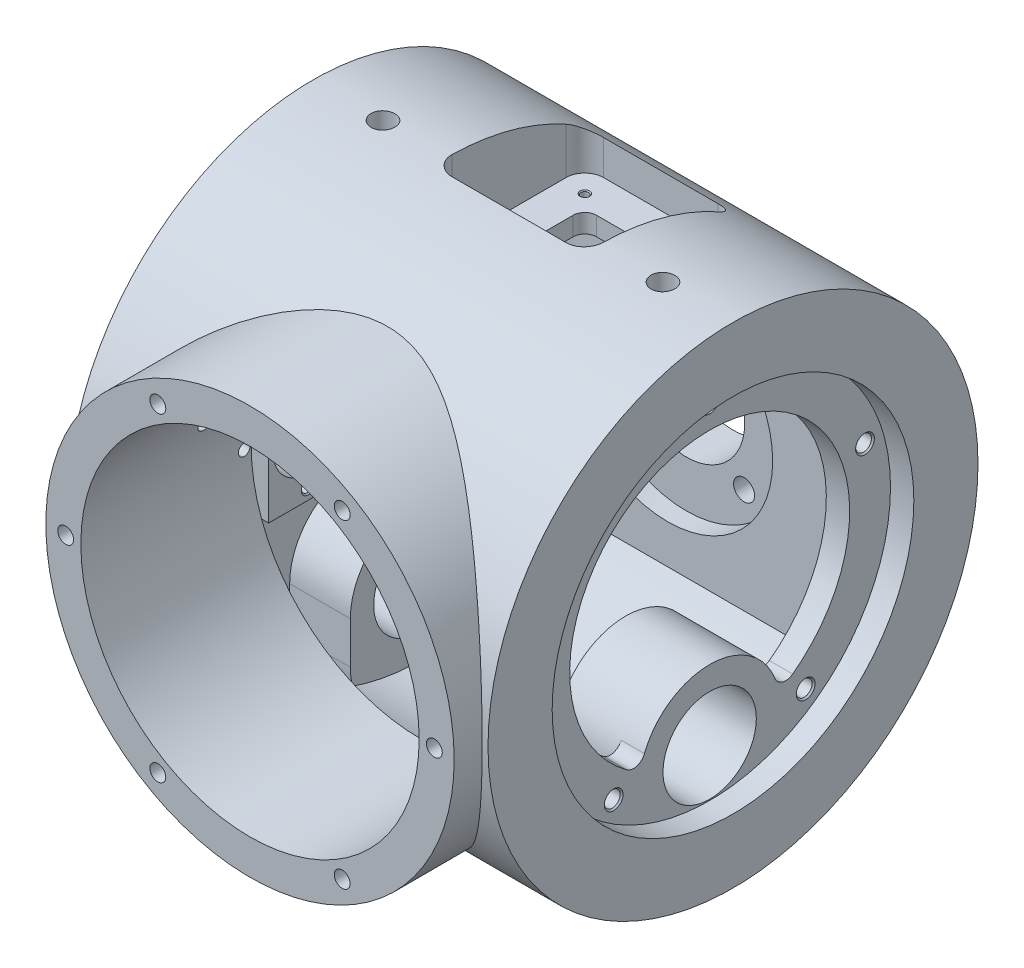
from build123d import *

# Parameters (mm, degrees)
SKETCH_2_R                   = 105
EXTRUDE_1_DEPTH              = 90
SKETCH_3_R                   = 87.5
EXTRUDE_2_DEPTH              = 117
SKETCH_4_R                   = 72.5
CUT_EXTRUDE_1_DEPTH          = 73
SKETCH_5_R                   = 77.5
CUT_EXTRUDE_2_DEPTH          = 10
SKETCH_7_R                   = 60
CUT_EXTRUDE_3_DEPTH          = 10
CUT_EXTRUDE_4_DEPTH          = 70
EXTRUDE_3_DEPTH              = 36
SKETCH_10_R                  = 20
CUT_EXTRUDE_5_DEPTH          = 36
CUT_EXTRUDE_START            = -10
SKETCH_11_R                  = 77.5
CUT_EXTRUDE_6_DEPTH          = 10
EXTRUDE_4_DEPTH              = 5
CUT_EXTRUDE_7_DEPTH          = 10
SKETCH_14_R                  = 15
CUT_EXTRUDE_8_DEPTH          = 221.769110329
SKETCH_15_R                  = 45
CUT_EXTRUDE_9_DEPTH          = 8
SKETCH_16_R                  = 25
CUT_EXTRUDE_10_DEPTH         = 20
SKETCH_17_R                  = 45
CUT_EXTRUDE_11_DEPTH         = 249.94577739
HOLE_WIZARD_M6_1_D           = 5
HOLE_WIZARD_M6_1_CSINK_D     = 6.05
HOLE_WIZARD_M6_1_CSINK_ANGLE = 90
PATTERN_CIRCULAR_1_COUNT     = 4
PATTERN_CIRCULAR_2_COUNT     = 5
FILLET_1_R                   = 5
CUT_EXTRUDE_START_2          = 8
CUT_EXTRUDE_12_DEPTH         = 217.388056891
CUT_EXTRUDE_13_REACH         = 232.473
CUT_EXTRUDE_START_3          = 61
SKETCH_26_W                  = 11
SKETCH_26_H                  = 11
CUT_EXTRUDE_14_DEPTH         = 121.146349847
F_10_0MM_1_D                 = 10
F_10_0MM_1_DEPTH             = 12
F_10_0MM_1_TIP               = 3.004303095
F_3_0MM_1_REACH              = 224.137
F_3_0MM_1_BORE_R             = 1.5
PATTERN_CIRCULAR_3_COUNT     = 6
HOLE_START                   = -90
HOLE_WIZARD_1_OUTLINE_R      = 4.5
HOLE_WIZARD_1_DEPTH          = 20
HOLE_WIZARD_1_2_OUTLINE_R    = 7
HOLE_WIZARD_1_2_OUTLINE_R_2  = 4.5
HOLE_WIZARD_1_2_DEPTH        = 6
PATTERN_CIRCULAR_4_COUNT     = 4
CUT_EXTRUDE_15_REACH         = 226.308
SKETCH_39_R                  = 2.5
CUT_EXTRUDE_16_DEPTH         = 182.146349847


# Read off the part's stored shape, not the designer's step: M4 螺纹孔1, M8 螺纹孔2, 孔1, M12 螺纹孔1
with BuildPart() as part:
    # 草图2 → 凸台-拉伸1 (new, symmetric)
    with BuildSketch(Plane(origin=(0, 0, 0), x_dir=(0, 0, -1), z_dir=(1, 0, 0))):
        with Locations(Location((0, 0, 0), (0, 0, 180))):
            Circle(SKETCH_2_R)
    extrude(amount=EXTRUDE_1_DEPTH, both=True)

    # 草图3 → 凸台-拉伸2 (add)
    with BuildSketch(Plane.XY):
        Circle(SKETCH_3_R)
    extrude(amount=EXTRUDE_2_DEPTH)

    # 草图4 → 切除-拉伸1 (cut)
    with BuildSketch(Plane.XY.offset(117)):
        Circle(SKETCH_4_R)
    extrude(amount=-CUT_EXTRUDE_1_DEPTH, mode=Mode.SUBTRACT)

    # 草图5 → 切除-拉伸2 (cut)
    with BuildSketch(Plane(origin=(90, 0, 0), x_dir=(0, 0, -1), z_dir=(1, 0, 0))):
        Circle(SKETCH_5_R)
    extrude(amount=-CUT_EXTRUDE_2_DEPTH, mode=Mode.SUBTRACT)

    # 草图7 → 切除-拉伸3 (cut)
    with BuildSketch(Plane(origin=(80, 0, 0), x_dir=(0, 0, -1), z_dir=(1, 0, 0))):
        Circle(SKETCH_7_R)
    extrude(amount=-CUT_EXTRUDE_3_DEPTH, mode=Mode.SUBTRACT)

    # 草图8 → 切除-拉伸4 (cut, symmetric)
    with BuildSketch(Plane(origin=(0, 0, 0), x_dir=(0, 0, -1), z_dir=(1, 0, 0))):
        with BuildLine():
            Line((-44, -75.632334355), (-44, 64))
            Line((-44, 64), (62, 64))
            Line((62, 64), (62, -61.743420702))
            ThreePointArc((62, -61.743420702), (11.367738588, -86.758426215), (-44, -75.632334355))
        make_face()
    extrude(amount=CUT_EXTRUDE_4_DEPTH, both=True, mode=Mode.SUBTRACT)

    # 草图9 → 凸台-拉伸3 (add)
    with BuildSketch(Plane(origin=(80, 0, 0), x_dir=(0, 0, -1), z_dir=(1, 0, 0))):
        with BuildLine():
            Line((30, -57), (30, -75))
            ThreePointArc((30, -75), (0, -105), (-30, -75))
            Line((-30, -75), (-30, -57))
            ThreePointArc((-30, -57), (0, -27), (30, -57))
        make_face()
    extrude_3 = extrude(amount=-EXTRUDE_3_DEPTH)

    # 草图10 → 切除-拉伸5 (cut)
    with BuildSketch(Plane(origin=(80, 0, 0), x_dir=(0, 0, -1), z_dir=(1, 0, 0))):
        with Locations((0, -57)):
            Circle(SKETCH_10_R)
    cut_extrude_5 = extrude(amount=-CUT_EXTRUDE_5_DEPTH, mode=Mode.SUBTRACT)

    # 镜向1: 凸台-拉伸3, 切除-拉伸5 across plane
    add(extrude_3.mirror(Plane(origin=(0, 0, 0), x_dir=(0, 0, 1), z_dir=(1, 0, 0))))
    add(cut_extrude_5.mirror(Plane(origin=(0, 0, 0), x_dir=(0, 0, 1), z_dir=(1, 0, 0))), mode=Mode.SUBTRACT)

    # 草图11 → 切除-拉伸6 (cut)
    with BuildSketch(Plane.ZY.offset(90).offset(CUT_EXTRUDE_START)):
        with Locations(Location((0, 0, 0), (0, 0, 180))):
            Circle(SKETCH_11_R)
    extrude(amount=CUT_EXTRUDE_6_DEPTH, mode=Mode.SUBTRACT)

    # 草图13 → 凸台-拉伸4 (add)
    with BuildSketch(Plane(origin=(-70, 0, 0), x_dir=(0, 0, -1), z_dir=(1, 0, 0))):
        with BuildLine():
            Line((-44, 25), (-27, 25))
            ThreePointArc((-27, 25), (-2, 0), (-27, -25))
            Line((-27, -25), (-44, -25))
            Line((-44, -25), (-44, 25))
        make_face()
    extrude(amount=EXTRUDE_4_DEPTH)

    # 草图12 → 切除-拉伸7 (cut)
    with BuildSketch(Plane(origin=(-70, 0, 0), x_dir=(0, 0, -1), z_dir=(1, 0, 0))):
        with BuildLine():
            Line((-20, 30.594117082), (-20, 48.989794856))
            ThreePointArc((-20, 48.989794856), (-17.745966692, 55.314350176), (-12, 58.787753827))
            ThreePointArc((-12, 58.787753827), (54.833730887, 24.356969371), (35.575054287, -48.315789474))
            ThreePointArc((35.575054287, -48.315789474), (31.21796574, -49.091654629), (27.951828368, -46.105263158))
            ThreePointArc((27.951828368, -46.105263158), (17.999414242, -32.999560692), (2.630976688, -27.11558999))
            ThreePointArc((2.630976688, -27.11558999), (-5.337009507, -21.819562802), (-5.20859363, -12.252942847))
            ThreePointArc((-5.20859363, -12.252942847), (-2.944098761, 6.805410758), (-14.857142857, 21.852940773))
            ThreePointArc((-14.857142857, 21.852940773), (-18.618916074, 25.523191553), (-20, 30.594117082))
        make_face()
    extrude(amount=-CUT_EXTRUDE_7_DEPTH, mode=Mode.SUBTRACT)

    # 草图14 → 切除-拉伸8 (cut, through all)
    with BuildSketch(Plane(origin=(-65, 0, 0), x_dir=(0, 0, -1), z_dir=(1, 0, 0))):
        with Locations((-27, 0)):
            Circle(SKETCH_14_R)
    extrude(amount=-CUT_EXTRUDE_8_DEPTH, mode=Mode.SUBTRACT)

    # 草图15 → 切除-拉伸9 (cut)
    with BuildSketch(Plane.XY.offset(-62)):
        Circle(SKETCH_15_R)
    extrude(amount=-CUT_EXTRUDE_9_DEPTH, mode=Mode.SUBTRACT)

    # 草图16 → 切除-拉伸10 (cut)
    with BuildSketch(Plane.XY.offset(-70)):
        Circle(SKETCH_16_R)
    extrude(amount=-CUT_EXTRUDE_10_DEPTH, mode=Mode.SUBTRACT)

    # 草图17 → 切除-拉伸11 (cut, through all)
    with BuildSketch(Plane.XY.offset(-90)):
        Circle(SKETCH_17_R)
    extrude(amount=-CUT_EXTRUDE_11_DEPTH, mode=Mode.SUBTRACT)

    # M6 螺纹孔1 (through all)
    with Locations(Plane(origin=(-65, 0, 0), x_dir=(0, 0, -1), z_dir=(1, 0, 0))):
        with Locations((-7, 0)):
            hole_wizard_m6_1 = CounterSinkHole(HOLE_WIZARD_M6_1_D / 2, HOLE_WIZARD_M6_1_CSINK_D / 2, counter_sink_angle=HOLE_WIZARD_M6_1_CSINK_ANGLE)

    # 阵列(圆周)1: M6 螺纹孔1 ×4 about axis
    pattern_circular_1_axis = Axis((0, 0, 27), (1, 0, 0))
    for i in range(1, PATTERN_CIRCULAR_1_COUNT):
        add(hole_wizard_m6_1.rotate(pattern_circular_1_axis, i * 360 / PATTERN_CIRCULAR_1_COUNT), mode=Mode.SUBTRACT)

    # 草图21 → M8 螺纹孔1 (revolve, cut)
    with BuildSketch(Plane(origin=(80, 70, 0), x_dir=(0, 0, -1), z_dir=(0, 1, 0))):
        Polygon((0, 0), (0, 20.042926105), (3.4, 18), (3.4, 0.625), (4.025, 0), align=None)
    hole_wizard_m8_1 = revolve(axis=Axis((86.35, 70, 0), (-1, 0, 0)), mode=Mode.SUBTRACT)

    # 阵列(圆周)2: M8 螺纹孔1 ×5 about axis
    pattern_circular_2_axis = Axis((0, 0, 0), (1, 0, 0))
    for i in range(1, PATTERN_CIRCULAR_2_COUNT):
        add(hole_wizard_m8_1.rotate(pattern_circular_2_axis, i * 360 / PATTERN_CIRCULAR_2_COUNT), mode=Mode.SUBTRACT)

    # 镜向2: M8 螺纹孔1 across plane
    add(hole_wizard_m8_1.mirror(Plane(origin=(0, 0, 0), x_dir=(0, 0, 1), z_dir=(1, 0, 0))), mode=Mode.SUBTRACT)

    # 镜向2 copy 1 sketch → 镜向2 copy 1 (revolve, cut)
    with BuildSketch(Plane(origin=(-80, 21.631189606, 66.573956141), x_dir=(0, 0.9510565162951535, -0.30901699437494745), z_dir=(0, 0.30901699437494745, 0.9510565162951535))):
        Polygon((0, 0), (0, -20.042926105), (3.4, -18), (3.4, -0.625), (4.025, 0), align=None)
    revolve(axis=Axis((-86.35, 21.631189606, 66.573956141), (-1, 0, 0)), mode=Mode.SUBTRACT)

    # 镜向2 copy 2 sketch → 镜向2 copy 2 (revolve, cut)
    with BuildSketch(Plane(origin=(-80, -56.631189606, 41.14496766), x_dir=(0, 0.5877852522924732, 0.8090169943749473), z_dir=(0, -0.8090169943749473, 0.5877852522924732))):
        Polygon((0, 0), (0, -20.042926105), (3.4, -18), (3.4, -0.625), (4.025, 0), align=None)
    revolve(axis=Axis((-86.35, -56.631189606, 41.14496766), (-1, 0, 0)), mode=Mode.SUBTRACT)

    # 镜向2 copy 3 sketch → 镜向2 copy 3 (revolve, cut)
    with BuildSketch(Plane(origin=(-80, -56.631189606, -41.14496766), x_dir=(0, -0.587785252292473, 0.8090169943749476), z_dir=(0, -0.8090169943749476, -0.587785252292473))):
        Polygon((0, 0), (0, -20.042926105), (3.4, -18), (3.4, -0.625), (4.025, 0), align=None)
    revolve(axis=Axis((-86.35, -56.631189606, -41.14496766), (-1, 0, 0)), mode=Mode.SUBTRACT)

    # 镜向2 copy 4 sketch → 镜向2 copy 4 (revolve, cut)
    with BuildSketch(Plane(origin=(-80, 21.631189606, -66.573956141), x_dir=(0, -0.9510565162951536, -0.30901699437494723), z_dir=(0, 0.30901699437494723, -0.9510565162951536))):
        Polygon((0, 0), (0, -20.042926105), (3.4, -18), (3.4, -0.625), (4.025, 0), align=None)
    revolve(axis=Axis((-86.35, 21.631189606, -66.573956141), (-1, 0, 0)), mode=Mode.SUBTRACT)

    # 圆角1
    fillet_1_edges = [part.edges().sort_by_distance(p)[0] for p in [
        (75, -52.184210526, -29.610946823),
        (75, -52.184210526, 29.610946823),
    ]]
    fillet(fillet_1_edges, radius=FILLET_1_R)

    # 草图22 → 切除-拉伸12 (cut, through all)
    with BuildSketch(Plane(origin=(0, 64, 0), x_dir=(1, 0, 0), z_dir=(0, 1, 0)).offset(CUT_EXTRUDE_START_2)):
        with BuildLine():
            Line((24.5, -6), (-24.5, -6))
            ThreePointArc((-24.5, -6), (-30.156854249, -3.656854249), (-32.5, 2))
            Line((-32.5, 2), (-32.5, 51))
            ThreePointArc((-32.5, 51), (-30.156854249, 56.656854249), (-24.5, 59))
            Line((-24.5, 59), (24.5, 59))
            ThreePointArc((24.5, 59), (30.156854249, 56.656854249), (32.5, 51))
            Line((32.5, 51), (32.5, 2))
            ThreePointArc((32.5, 2), (30.156854249, -3.656854249), (24.5, -6))
        make_face()
    extrude(amount=CUT_EXTRUDE_12_DEPTH, mode=Mode.SUBTRACT)

    # 草图23 → 切除-拉伸13 (cut, up to next)
    with BuildSketch(Plane(origin=(0, 72, 0), x_dir=(1, 0, 0), z_dir=(0, 1, 0)), mode=Mode.PRIVATE) as cut_extrude_13_sk1:
        with BuildLine():
            Line((12, 9.5), (-12, 9.5))
            ThreePointArc((-12, 9.5), (-15.535533906, 10.964466094), (-17, 14.5))
            Line((-17, 14.5), (-17, 38.5))
            ThreePointArc((-17, 38.5), (-15.535533906, 42.035533906), (-12, 43.5))
            Line((-12, 43.5), (12, 43.5))
            ThreePointArc((12, 43.5), (15.535533906, 42.035533906), (17, 38.5))
            Line((17, 38.5), (17, 14.5))
            ThreePointArc((17, 14.5), (15.535533906, 10.964466094), (12, 9.5))
        make_face()
    cut_extrude_13_tool1 = extrude(cut_extrude_13_sk1.sketch, amount=-CUT_EXTRUDE_13_REACH, mode=Mode.PRIVATE) & part.part
    add(cut_extrude_13_tool1.solids().sort_by_distance((0, 72, -26.5))[0], mode=Mode.SUBTRACT)

    # M4 螺纹孔1 outline → M4 螺纹孔1 (revolve, cut)
    with BuildSketch(Plane(origin=(-22.5, 0, -4), x_dir=(1, 0, 0), z_dir=(0, 0, 1))):
        Polygon((0, 64), (1.65, 64), (1.65, 71.625), (2.025, 72), (0, 72), align=None)
    revolve(axis=Axis((-22.5, 0, -4), (0, 1, 0)), mode=Mode.SUBTRACT)

    # Hole Wizard M4 _1 2 outline → Hole Wizard M4 _1 2 (revolve, cut)
    with BuildSketch(Plane(origin=(22.5, 0, -49), x_dir=(1, 0, 0), z_dir=(0, 0, 1))):
        Polygon((0, 64), (1.65, 64), (1.65, 71.625), (2.025, 72), (0, 72), align=None)
    revolve(axis=Axis((22.5, 0, -49), (0, 1, 0)), mode=Mode.SUBTRACT)

    # Hole Wizard M4 _1 3 outline → Hole Wizard M4 _1 3 (revolve, cut)
    with BuildSketch(Plane(origin=(22.5, 0, -4), x_dir=(1, 0, 0), z_dir=(0, 0, 1))):
        Polygon((0, 64), (1.65, 64), (1.65, 71.625), (2.025, 72), (0, 72), align=None)
    revolve(axis=Axis((22.5, 0, -4), (0, 1, 0)), mode=Mode.SUBTRACT)

    # Hole Wizard M4 _1 4 outline → Hole Wizard M4 _1 4 (revolve, cut)
    with BuildSketch(Plane(origin=(-22.5, 0, -49), x_dir=(1, 0, 0), z_dir=(0, 0, 1))):
        Polygon((0, 64), (1.65, 64), (1.65, 71.625), (2.025, 72), (0, 72), align=None)
    revolve(axis=Axis((-22.5, 0, -49), (0, 1, 0)), mode=Mode.SUBTRACT)

    # 草图26 → 切除-拉伸14 (cut, through all)
    with BuildSketch(Plane(origin=(0, 0, 0), x_dir=(1, 0, 0), z_dir=(0, 1, 0)).offset(CUT_EXTRUDE_START_3)):
        with Locations((0, 80)):
            Rectangle(SKETCH_26_W, SKETCH_26_H)
    extrude(amount=CUT_EXTRUDE_14_DEPTH, mode=Mode.SUBTRACT)

    # Ø10.0mm 暗销孔1
    with Locations(Plane(origin=(0, 61, -79.981721238), x_dir=(0, 0, 1), z_dir=(0, 1, 0))):
        with Locations((0, 0)):
            Hole(F_10_0MM_1_D / 2, depth=F_10_0MM_1_DEPTH)
            with Locations((0, 0, -(F_10_0MM_1_DEPTH + F_10_0MM_1_TIP / 2))):  # 118° drill point
                Cone(0, F_10_0MM_1_D / 2, F_10_0MM_1_TIP, mode=Mode.SUBTRACT)

    # Ø3.0mm 暗销孔1 bore → Ø3.0mm 暗销孔1 (cut, up to next)
    with BuildSketch(Plane(origin=(0, 61, 0), x_dir=(1, 0, 0), z_dir=(0, 1, 0)), mode=Mode.PRIVATE) as f_3_0mm_1_sk1:
        with Locations((0, 79.981721238)):
            Circle(F_3_0MM_1_BORE_R)
    f_3_0mm_1_tool1 = extrude(f_3_0mm_1_sk1.sketch, amount=-F_3_0MM_1_REACH, mode=Mode.PRIVATE) & part.part
    add(f_3_0mm_1_tool1.solids().sort_by_distance((0, 61, -79.981721))[0], mode=Mode.SUBTRACT)

    # M8 螺纹孔2 outline → M8 螺纹孔2 (revolve, cut)
    with BuildSketch(Plane(origin=(79, 0, 0), x_dir=(1, 0, 0), z_dir=(0, -1, 0))):
        Polygon((0, 117), (0, 88.957073895), (3.4, 91), (3.4, 117), align=None)
    hole_wizard_m8_2 = revolve(axis=Axis((79, 0, 0), (0, 0, 1)), mode=Mode.SUBTRACT)

    # 阵列(圆周)3: M8 螺纹孔2 ×6 about axis
    pattern_circular_3_axis = Axis((0, 0, 0), (0, 0, 1))
    for i in range(1, PATTERN_CIRCULAR_3_COUNT):
        add(hole_wizard_m8_2.rotate(pattern_circular_3_axis, i * 360 / PATTERN_CIRCULAR_3_COUNT), mode=Mode.SUBTRACT)

    # 孔1 outline → 孔1 (cut)
    with BuildSketch(Plane.XY.offset(HOLE_START)):
        with Locations((-24.748737342, 24.748737342)):
            Circle(HOLE_WIZARD_1_OUTLINE_R)
    hole_wizard_1 = extrude(amount=HOLE_WIZARD_1_DEPTH, mode=Mode.SUBTRACT)

    # Hole Wizard 1 2 outline → Hole Wizard 1 2 (cut)
    with BuildSketch(Plane.XY.offset(HOLE_START)):
        with Locations((-24.748737342, 24.748737342)):
            Circle(HOLE_WIZARD_1_2_OUTLINE_R)
        with Locations((-24.748737342, 24.748737342)):
            Circle(HOLE_WIZARD_1_2_OUTLINE_R_2, mode=Mode.SUBTRACT)
    hole_wizard_1_2 = extrude(amount=HOLE_WIZARD_1_2_DEPTH, mode=Mode.SUBTRACT)

    # 阵列(圆周)4: 孔1, Hole Wizard 1 2 ×4 about axis
    pattern_circular_4_axis = Axis((0, 0, 0), (0, 0, 1))
    add([hole_wizard_1.rotate(pattern_circular_4_axis, i * 360 / PATTERN_CIRCULAR_4_COUNT) for i in range(1, PATTERN_CIRCULAR_4_COUNT)], mode=Mode.SUBTRACT)
    add([hole_wizard_1_2.rotate(pattern_circular_4_axis, i * 360 / PATTERN_CIRCULAR_4_COUNT) for i in range(1, PATTERN_CIRCULAR_4_COUNT)], mode=Mode.SUBTRACT)

    # 草图36 → 切除-拉伸15 (cut, up to next)
    with BuildSketch(Plane(origin=(70, 0, 0), x_dir=(0, 0, -1), z_dir=(1, 0, 0)), mode=Mode.PRIVATE) as cut_extrude_15_sk1:
        with BuildLine():
            Line((-44, 18.874586088), (-44, 40.792156109))
            ThreePointArc((-44, 40.792156109), (-51.652869246, 30.528365476), (-56.953928749, 18.874586088))
            Line((-56.953928749, 18.874586088), (-44, 18.874586088))
        make_face()
    cut_extrude_15_tool1 = extrude(cut_extrude_15_sk1.sketch, amount=-CUT_EXTRUDE_15_REACH, mode=Mode.PRIVATE) & part.part
    # 草图36 → 切除-拉伸15 (cut, up to next)
    with BuildSketch(Plane(origin=(70, 0, 0), x_dir=(0, 0, -1), z_dir=(1, 0, 0)), mode=Mode.PRIVATE) as cut_extrude_15_sk2:
        with BuildLine():
            Line((-44, -40.792156109), (-44, -18.874586088))
            Line((-44, -18.874586088), (-56.953928749, -18.874586088))
            ThreePointArc((-56.953928749, -18.874586088), (-51.652869246, -30.528365476), (-44, -40.792156109))
        make_face()
    cut_extrude_15_tool2 = extrude(cut_extrude_15_sk2.sketch, amount=-CUT_EXTRUDE_15_REACH, mode=Mode.PRIVATE) & part.part
    add(cut_extrude_15_tool1.solids().sort_by_distance((70, 26.733421, 48.687896))[0], mode=Mode.SUBTRACT)
    add(cut_extrude_15_tool2.solids().sort_by_distance((70, -26.733421, 48.687896))[0], mode=Mode.SUBTRACT)

    # M12 螺纹孔1 outline → M12 螺纹孔1 (revolve, cut)
    with BuildSketch(Plane(origin=(-60, 0, 0), x_dir=(1, 0, 0), z_dir=(0, 0, 1))):
        Polygon((0, 73.935610843), (5.1, 77), (5.1, 105.000033476), (0, 105.000033476), align=None)
    revolve(axis=Axis((-60, 0, 0), (0, 1, 0)), mode=Mode.SUBTRACT)

    # Hole Wizard M12 _1 2 outline → Hole Wizard M12 _1 2 (revolve, cut)
    with BuildSketch(Plane(origin=(60, 0, 0), x_dir=(1, 0, 0), z_dir=(0, 0, 1))):
        Polygon((0, 73.935610843), (5.1, 77), (5.1, 105.000033476), (0, 105.000033476), align=None)
    revolve(axis=Axis((60, 0, 0), (0, 1, 0)), mode=Mode.SUBTRACT)

    # 草图39 → 切除-拉伸16 (cut, through all)
    with BuildSketch(Plane(origin=(0, 0, 0), x_dir=(1, 0, 0), z_dir=(0, 1, 0))):
        with Locations(Location((0, 0, 0), (0, 0, 270))):
            Circle(SKETCH_39_R)
    extrude(amount=-CUT_EXTRUDE_16_DEPTH, mode=Mode.SUBTRACT)


solid = part.part
